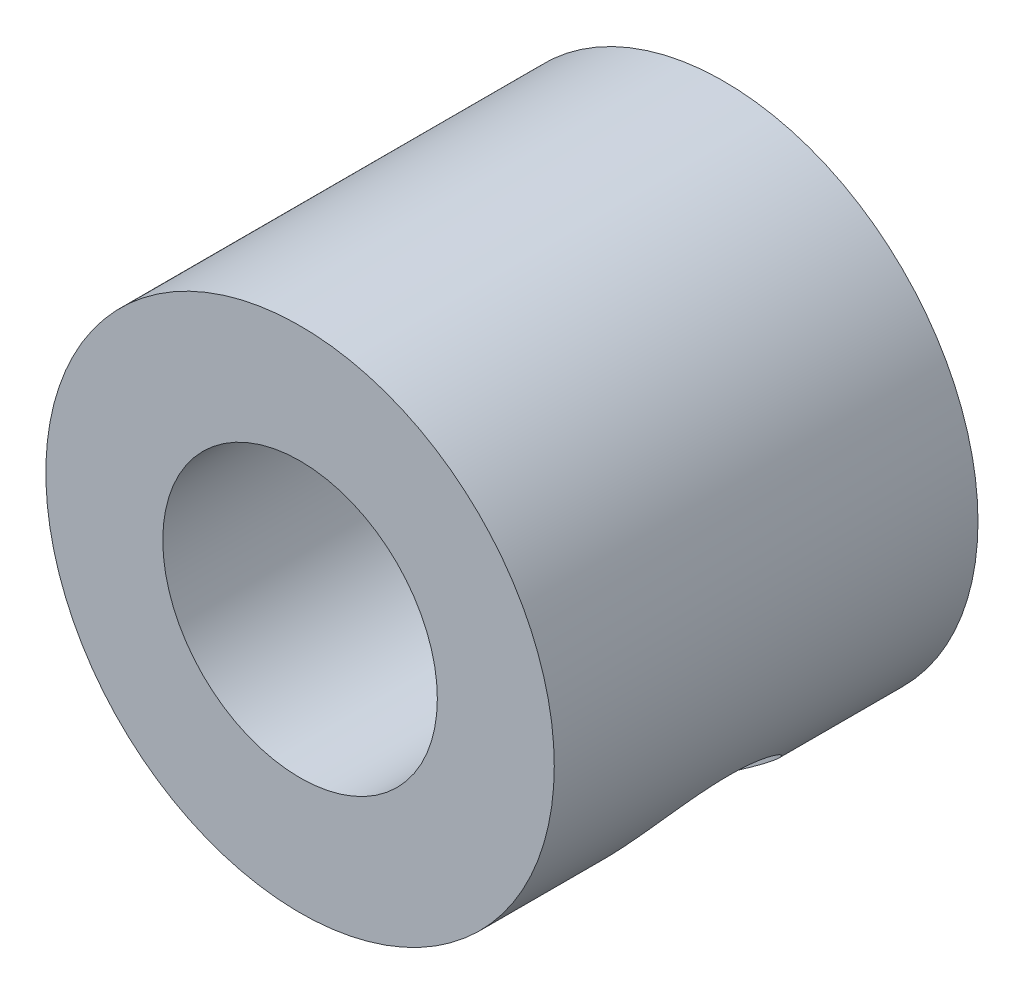
from build123d import *

# Parameters (mm, degrees)
SKETCH1_R                     = 3
SKETCH1_R_2                   = 1.62
EXTRUDE1_DEPTH                = 5
F_4_40_TAPPED_HOLE1_OUTLINE_W = 1.1303
F_4_40_TAPPED_HOLE1_OUTLINE_H = 1.839757257


# Read off the part's stored shape, not the designer's step: #4-40 Tapped Hole1
with BuildPart() as part:
    # Sketch1 → Extrude1 (new body)
    with BuildSketch(Plane.XY):
        Circle(SKETCH1_R)
        Circle(SKETCH1_R_2, mode=Mode.SUBTRACT)
    extrude(amount=EXTRUDE1_DEPTH)

    # #4-40 Tapped Hole1 outline → #4-40 Tapped Hole1 (revolve, cut)
    with BuildSketch(Plane(origin=(0, 0, 2.5), x_dir=(0.8048278392446406, 0.5935083396017303, 0), z_dir=(0, 0, -1))):
        with Locations((0.56515, 2.080149877)):
            Rectangle(F_4_40_TAPPED_HOLE1_OUTLINE_W, F_4_40_TAPPED_HOLE1_OUTLINE_H)
    revolve(axis=Axis((0, 0, 2.5), (0.5935083396017303, -0.8048278392446406, 0)), mode=Mode.SUBTRACT)


solid = part.part
